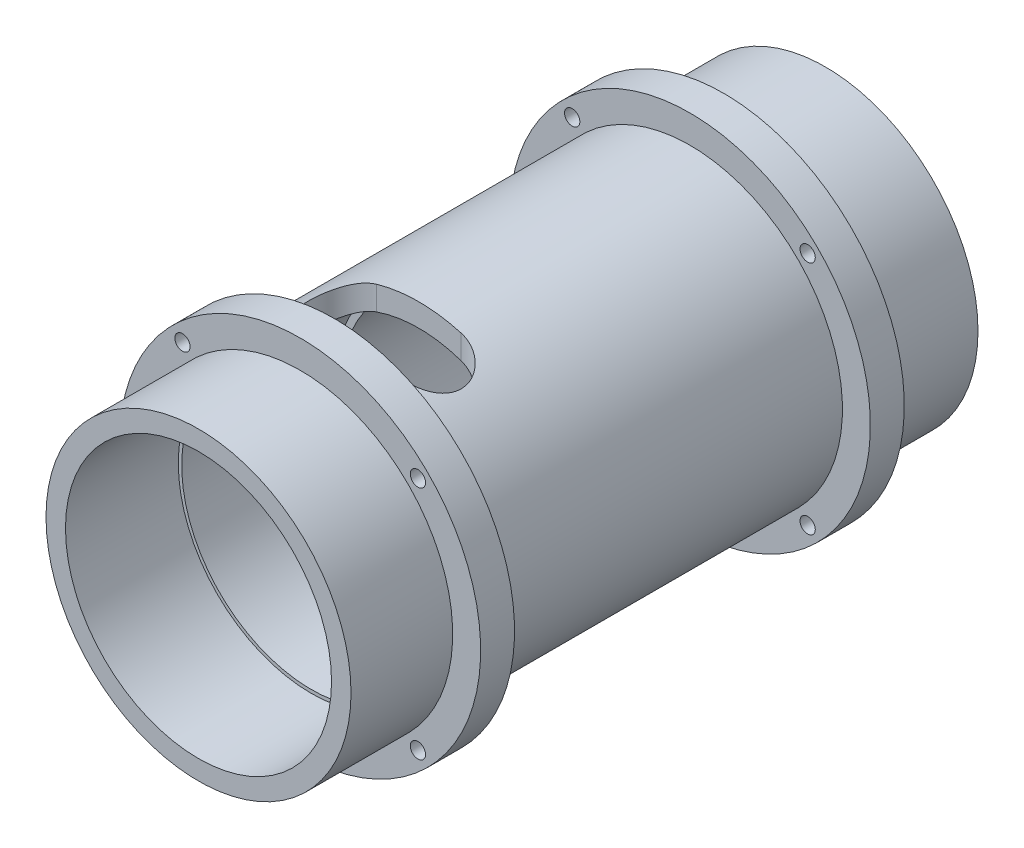
from build123d import *

# Parameters (mm, degrees)
SKETCH1_R            = 45
SKETCH1_R_2          = 33.75
BOSS_EXTRUDE1_DEPTH  = 92.5
SKETCH4_W            = 10
SKETCH4_H            = 8.25
M4_CLEARANCE_HOLE1_D = 4.5
CUT_EXTRUDE1_DEPTH   = 120.278560521


with BuildPart() as part:
    # Sketch1 → Boss-Extrude1 (new, symmetric)
    with BuildSketch(Plane.XY):
        Circle(SKETCH1_R)
        Circle(SKETCH1_R_2, mode=Mode.SUBTRACT)
    extrude(amount=BOSS_EXTRUDE1_DEPTH, both=True)

    # Sketch2 → Cut-Revolve1 (revolve, cut)
    with BuildSketch(Plane(origin=(0, 0, 0), x_dir=(1, 0, 0), z_dir=(0, 1, 0))):
        Polygon((0, -92.5), (0, 92.5), (-38.25, 92.5), (-38.25, 86.15), (-36.25, 86.15), (-36.25, -13.85), (-38.25, -13.85), (-38.25, -59.21294831), (-39.25, -59.21294831), (-39.25, -92.5), align=None)
    revolve(axis=Axis((0, 0, 92.5), (0, 0, -1)), mode=Mode.SUBTRACT)

    # Sketch4 → Revolve1 (revolve)
    with BuildSketch(Plane(origin=(0, 0, 0), x_dir=(0, 0, -1), z_dir=(1, 0, 0))):
        with Locations((-57.5, 49.125)):
            Rectangle(SKETCH4_W, SKETCH4_H)
        with Locations((57.5, 49.125)):
            Rectangle(SKETCH4_W, SKETCH4_H)
    revolve(axis=Axis((0, 0, -92.5), (0, 0, 1)))

    # M4 Clearance Hole1 (through all)
    with Locations(Plane.XY.offset(62.5)):
        with Locations((34.736620626, -34.736620626), (-34.736620626, 34.736620626), (34.736620626, 34.736620626), (-34.736620626, -34.736620626)):
            Hole(M4_CLEARANCE_HOLE1_D / 2)

    # Sketch3 → Cut-Extrude1 (cut, through all)
    with BuildSketch(Plane(origin=(0, 0, 0), x_dir=(1, 0, 0), z_dir=(0, 1, 0))):
        with BuildLine():
            Line((-12.5, -27.5), (12.5, -27.5))
            ThreePointArc((12.5, -27.5), (22.5, -37.5), (12.5, -47.5))
            Line((12.5, -47.5), (-12.5, -47.5))
            ThreePointArc((-12.5, -47.5), (-22.5, -37.5), (-12.5, -27.5))
        make_face()
    extrude(amount=CUT_EXTRUDE1_DEPTH, mode=Mode.SUBTRACT)


solid = part.part
